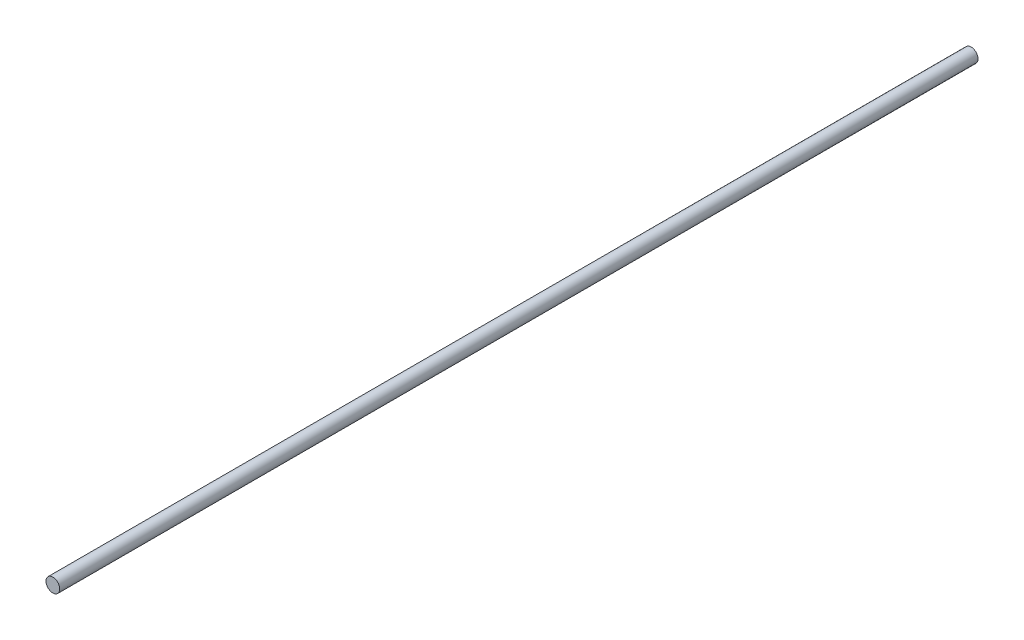
from build123d import *

# Parameters (mm, degrees)
SKETCH1_R           = 3
BOSS_EXTRUDE1_DEPTH = 200


with BuildPart() as part:
    # Sketch1 → Boss-Extrude1 (new, symmetric)
    with BuildSketch(Plane.XY):
        Circle(SKETCH1_R)
    extrude(amount=BOSS_EXTRUDE1_DEPTH, both=True)


solid = part.part
